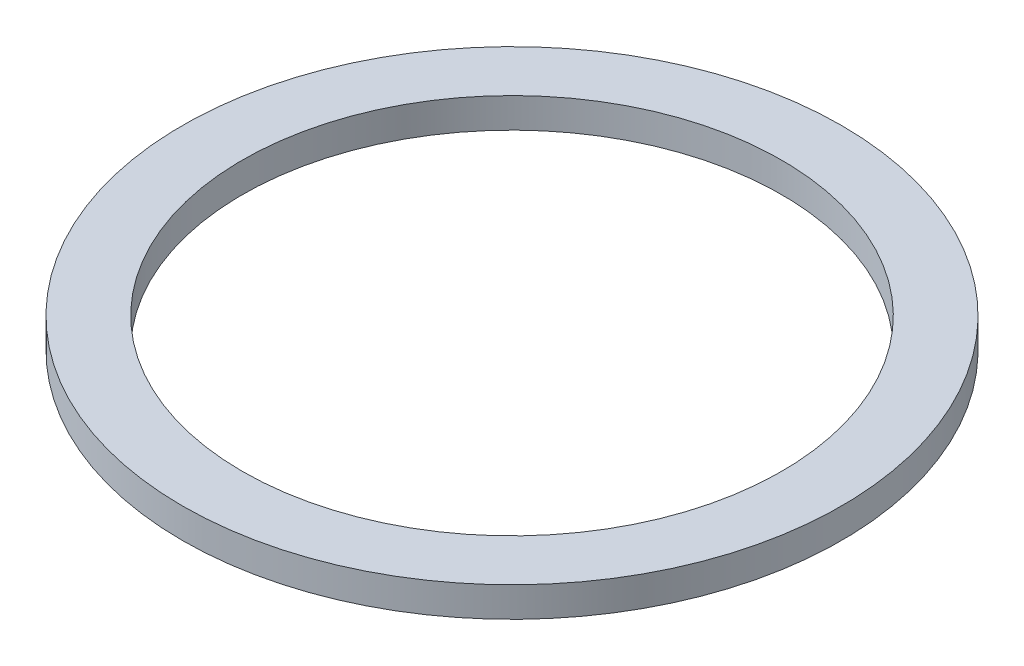
from build123d import *

# Parameters (mm, degrees)
SKETCH1_R           = 55
BOSS_EXTRUDE1_DEPTH = 5
SKETCH2_R           = 45
CUT_EXTRUDE1_DEPTH  = 78.942286341


with BuildPart() as part:
    # Sketch1 → Boss-Extrude1 (new body)
    with BuildSketch(Plane(origin=(0, 0, 0), x_dir=(1, 0, 0), z_dir=(0, 1, 0))):
        Circle(SKETCH1_R)
    extrude(amount=BOSS_EXTRUDE1_DEPTH)

    # Sketch2 → Cut-Extrude1 (cut, through all)
    with BuildSketch(Plane(origin=(0, 0, 0), x_dir=(1, 0, 0), z_dir=(0, 1, 0))):
        Circle(SKETCH2_R)
    extrude(amount=CUT_EXTRUDE1_DEPTH, mode=Mode.SUBTRACT)


solid = part.part
